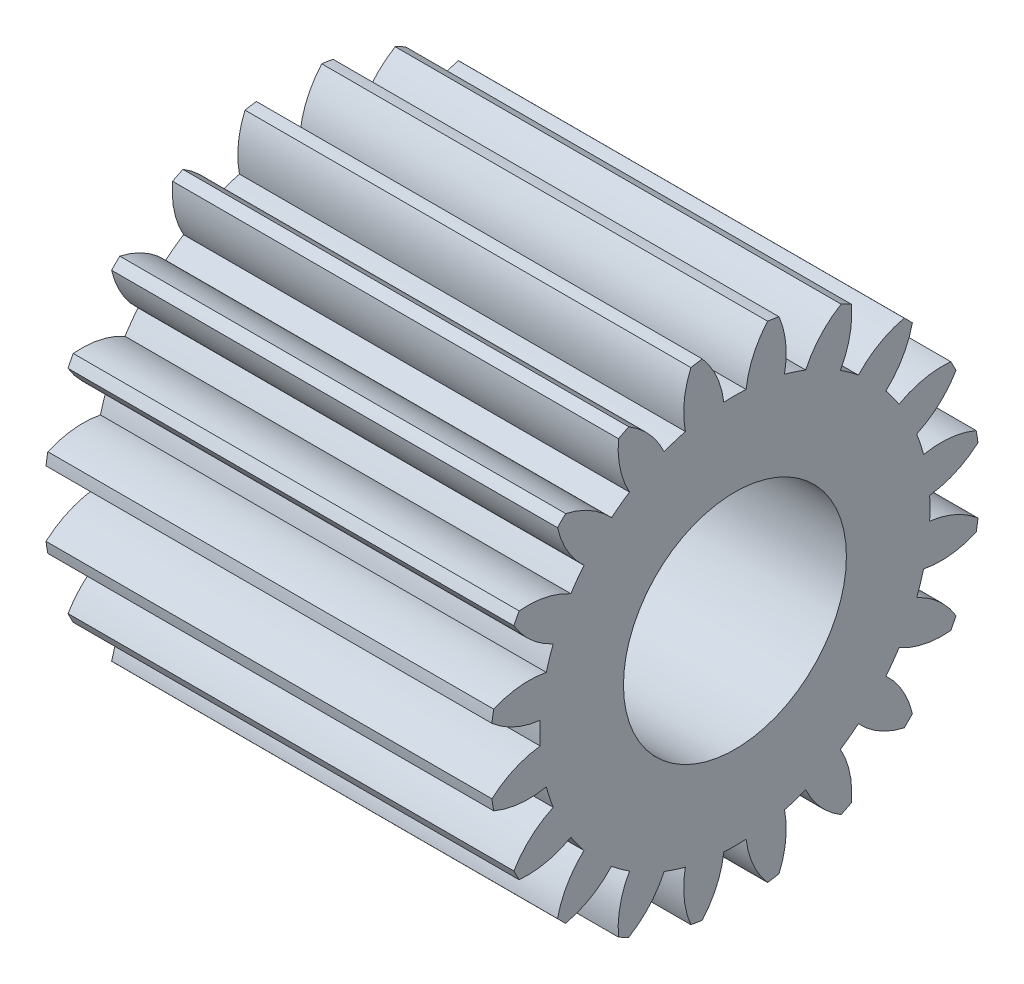
from build123d import *

# Parameters (mm, degrees)
BASPROSKE_W     = 10
BASPROSKE_H     = 5.5
TOOTHCUT_DEPTH  = 13.668859459
TEETHCUTS_COUNT = 20
TEETHCUTS_ANGLE = 342
BORSKE_R        = 2.5
BORE_DEPTH      = 50.0000508


with BuildPart() as part:
    # BasProSke → Base-Revolve (revolve)
    with BuildSketch(Plane(origin=(0, 0, 0), x_dir=(1, 0, 0), z_dir=(0, 1, 0))):
        with Locations((5, 2.75)):
            Rectangle(BASPROSKE_W, BASPROSKE_H)
    revolve(axis=Axis((-10, 0, 0), (1, 0, 0)))

    # TooCutSke → ToothCut (cut, through all)
    with BuildSketch(Plane(origin=(0, 0, 0), x_dir=(0, 0, -1), z_dir=(1, 0, 0))):
        with BuildLine():
            ThreePointArc((0.249903181, 4.366855207), (0, 4.374), (-0.249903181, 4.366855207))
            ThreePointArc((-0.249903181, 4.366855207), (-0.415207844, 4.95951031), (-0.752843848, 5.473871692))
            ThreePointArc((-0.752843848, 5.473871692), (0, 5.5254), (0.752843848, 5.473871692))
            ThreePointArc((0.752843848, 5.473871692), (0.415207844, 4.95951031), (0.249903181, 4.366855207))
        make_face()
    toothcut = extrude(amount=TOOTHCUT_DEPTH, mode=Mode.SUBTRACT)

    # TeethCuts: ToothCut ×20 about axis
    teethcuts_axis = Axis((-10, 0, 0), (1, 0, 0))
    for i in range(1, TEETHCUTS_COUNT):
        add(toothcut.rotate(teethcuts_axis, i * TEETHCUTS_ANGLE / (TEETHCUTS_COUNT - 1)), mode=Mode.SUBTRACT)

    # BorSke → Bore (cut, symmetric)
    with BuildSketch(Plane(origin=(0, 0, 0), x_dir=(0, 0, -1), z_dir=(1, 0, 0))):
        Circle(BORSKE_R)
    extrude(amount=BORE_DEPTH, both=True, mode=Mode.SUBTRACT)


solid = part.part
